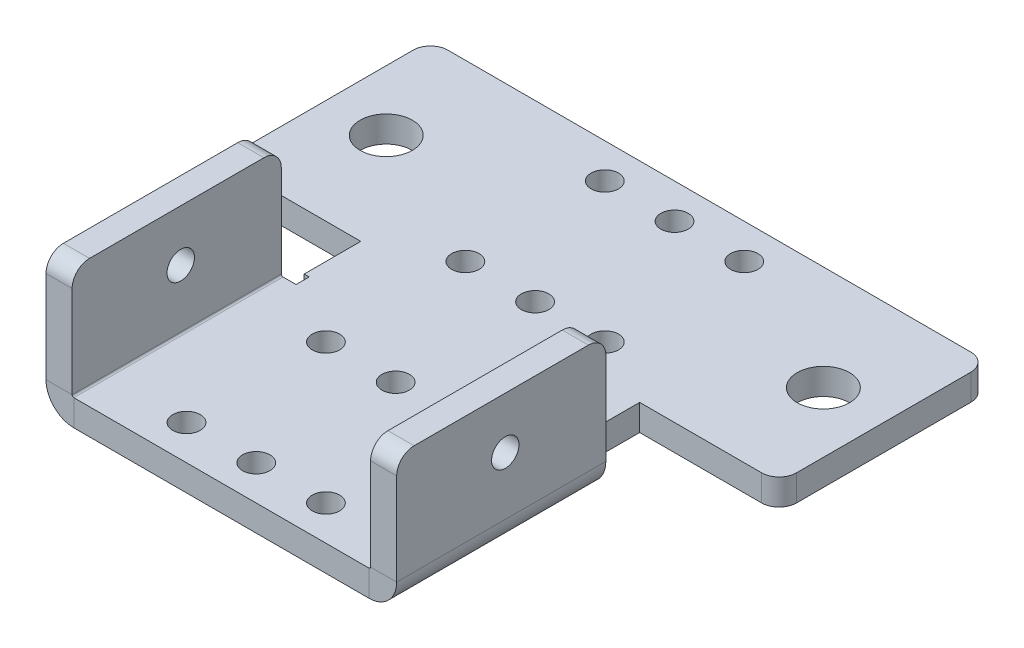
from build123d import *

# Parameters (mm, degrees)
T_LE_DE_BASE_PLI_E1_DEPTH                = 4.76
T_LE_PLI_E_SUR_AR_TE1_STRIP_W            = 19.665
T_LE_PLI_E_SUR_AR_TE1_STRIP_H            = 4.76
T_LE_PLI_E_SUR_AR_TE1_STRIP_CUT_DEPTH    = 38.1
T_LE_PLI_E_SUR_AR_TE1_RELIEF_W           = 22.045
T_LE_PLI_E_SUR_AR_TE1_RELIEF_H           = 2.38
T_LE_PLI_E_SUR_AR_TE1_RELIEF_CUT_DEPTH   = 4.76
T_LE_PLI_E_SUR_AR_TE1_STRIP_2_W          = 19.665
T_LE_PLI_E_SUR_AR_TE1_STRIP_2_H          = 4.76
T_LE_PLI_E_SUR_AR_TE1_STRIP_CUT_2_DEPTH  = 38.1
T_LE_PLI_E_SUR_AR_TE1_RELIEF_2_W         = 22.045
T_LE_PLI_E_SUR_AR_TE1_RELIEF_2_H         = 2.38
T_LE_PLI_E_SUR_AR_TE1_RELIEF_CUT_2_DEPTH = 4.76
T_LE_PLI_E_SUR_AR_TE1_DEPTH              = 38.1
T_LE_PLI_E_SUR_AR_TE1_BEND_DEPTH         = 38.1
ENL_V_MAT_EXTRU_1_REACH                  = 90.709
ESQUISSE12_W                             = 6.54
ESQUISSE12_H                             = 10.32
CONG_1_R                                 = 3.175
ESQUISSE13_R                             = 4.7625
ENL_V_MAT_EXTRU_3_DEPTH                  = 89.709188363
DIAM_TRE_DU_PER_AGE_5_0_5_1_D            = 5
R_P_TITION_LIN_AIRE1_COUNT               = 4
R_P_TITION_LIN_AIRE1_PITCH               = 25.4
DIAM_TRE_DU_PER_AGE_5_0_5_2_D            = 5
DIAM_TRE_DU_PER_AGE_5_0_5_2_DEPTH        = 4.76
DIAM_TRE_DU_PER_AGE_5_0_5_3_D            = 5


# Sheet-metal steps are written as plain solids
with BuildPart() as part:
    # Esquisse1 → Tôle de base pliée1 (new body)
    with BuildSketch(Plane(origin=(0, 0, 0), x_dir=(1, 0, 0), z_dir=(0, 1, 0))):
        Polygon((-31.94, -19.05), (-31.94, -69.85), (31.94, -69.85), (31.94, -19.05), (50.8, -19.05), (50.8, 19.05), (-50.8, 19.05), (-50.8, -19.05), align=None)
    extrude(amount=-T_LE_DE_BASE_PLI_E1_DEPTH)

    # Tôle pliée sur arête1 strip (across the edge) → Tôle pliée sur arête1 strip cut (cut)
    with BuildSketch(Plane(origin=(-31.94, 0, 31.75), x_dir=(1, 0, 0), z_dir=(0, 0, 1))):
        with Locations((-4.76, -2.38)):
            Rectangle(T_LE_PLI_E_SUR_AR_TE1_STRIP_W, T_LE_PLI_E_SUR_AR_TE1_STRIP_H)
    extrude(amount=T_LE_PLI_E_SUR_AR_TE1_STRIP_CUT_DEPTH, mode=Mode.SUBTRACT)

    # Tôle pliée sur arête1 relief (on the sheet) → Tôle pliée sur arête1 relief cut (cut)
    with BuildSketch(Plane(origin=(-26.8675, 0, 31.75), x_dir=(1, 0, 0), z_dir=(0, 1, 0))):
        with Locations((-8.6425, 1.19)):
            Rectangle(T_LE_PLI_E_SUR_AR_TE1_RELIEF_W, T_LE_PLI_E_SUR_AR_TE1_RELIEF_H)
    extrude(amount=-T_LE_PLI_E_SUR_AR_TE1_RELIEF_CUT_DEPTH, mode=Mode.SUBTRACT)

    # Tôle pliée sur arête1 strip 2 (across the edge) → Tôle pliée sur arête1 strip cut 2 (cut)
    with BuildSketch(Plane(origin=(31.94, 0, 69.85), x_dir=(-1, 0, 0), z_dir=(0, 0, -1))):
        with Locations((-4.76, -2.38)):
            Rectangle(T_LE_PLI_E_SUR_AR_TE1_STRIP_2_W, T_LE_PLI_E_SUR_AR_TE1_STRIP_2_H)
    extrude(amount=T_LE_PLI_E_SUR_AR_TE1_STRIP_CUT_2_DEPTH, mode=Mode.SUBTRACT)

    # Tôle pliée sur arête1 relief 2 (on the sheet) → Tôle pliée sur arête1 relief cut 2 (cut)
    with BuildSketch(Plane(origin=(26.8675, 0, 69.85), x_dir=(-1, 0, 0), z_dir=(0, 1, 0))):
        with Locations((-8.6425, -39.29)):
            Rectangle(T_LE_PLI_E_SUR_AR_TE1_RELIEF_2_W, T_LE_PLI_E_SUR_AR_TE1_RELIEF_2_H)
    extrude(amount=-T_LE_PLI_E_SUR_AR_TE1_RELIEF_CUT_2_DEPTH, mode=Mode.SUBTRACT)

    # Tôle pliée sur arête1 section (across the edge) → Tôle pliée sur arête1 (add)
    with BuildSketch(Plane(origin=(-31.94, 0, 31.75), x_dir=(1, 0, 0), z_dir=(0, 0, 1))):
        with BuildLine():
            Line((0, 0.3125), (0, 20.24))
            Line((0, 20.24), (4.76, 20.24))
            Line((4.76, 20.24), (4.76, 0.3125))
            ThreePointArc((4.76, 0.3125), (4.851529131, 0.091529131), (5.0725, 0))
            Line((5.0725, 0), (5.0725, -4.76))
            ThreePointArc((5.0725, -4.76), (1.485700852, -3.274299148), (0, 0.3125))
        make_face()
    extrude(amount=T_LE_PLI_E_SUR_AR_TE1_DEPTH)

    # Tôle pliée sur arête1 section 2 (across the edge) → Tôle pliée sur arête1 bend (add)
    with BuildSketch(Plane(origin=(31.94, 0, 69.85), x_dir=(-1, 0, 0), z_dir=(0, 0, -1))):
        with BuildLine():
            Line((0, 0.3125), (0, 20.24))
            Line((0, 20.24), (4.76, 20.24))
            Line((4.76, 20.24), (4.76, 0.3125))
            ThreePointArc((4.76, 0.3125), (4.851529131, 0.091529131), (5.0725, 0))
            Line((5.0725, 0), (5.0725, -4.76))
            ThreePointArc((5.0725, -4.76), (1.485700852, -3.274299148), (0, 0.3125))
        make_face()
    extrude(amount=T_LE_PLI_E_SUR_AR_TE1_BEND_DEPTH)

    # Esquisse12 → Enlèv. mat.-Extru.1 (cut, up to next)
    with BuildSketch(Plane(origin=(0, 0, 0), x_dir=(1, 0, 0), z_dir=(0, 1, 0)), mode=Mode.PRIVATE) as enl_v_mat_extru_1_sk1:
        with Locations((-28.67, -24.21)):
            Rectangle(ESQUISSE12_W, ESQUISSE12_H)
    enl_v_mat_extru_1_tool1 = extrude(enl_v_mat_extru_1_sk1.sketch, amount=-ENL_V_MAT_EXTRU_1_REACH, mode=Mode.PRIVATE) & part.part
    # Esquisse12 → Enlèv. mat.-Extru.1 (cut, up to next)
    with BuildSketch(Plane(origin=(0, 0, 0), x_dir=(1, 0, 0), z_dir=(0, 1, 0)), mode=Mode.PRIVATE) as enl_v_mat_extru_1_sk2:
        with Locations((28.67, -24.21)):
            Rectangle(ESQUISSE12_W, ESQUISSE12_H)
    enl_v_mat_extru_1_tool2 = extrude(enl_v_mat_extru_1_sk2.sketch, amount=-ENL_V_MAT_EXTRU_1_REACH, mode=Mode.PRIVATE) & part.part
    add(enl_v_mat_extru_1_tool1.solids().sort_by_distance((-28.67, 0, 24.21))[0], mode=Mode.SUBTRACT)
    add(enl_v_mat_extru_1_tool2.solids().sort_by_distance((28.67, 0, 24.21))[0], mode=Mode.SUBTRACT)

    # Congé1
    cong_1_edges = [part.edges().sort_by_distance(p)[0] for p in [
        (-50.8, -2.38, 19.05),
        (-50.8, -2.38, -19.05),
        (50.8, -2.38, -19.05),
        (50.8, -2.38, 19.05),
        (-29.56, 20.24, 31.75),
        (-29.56, 20.24, 69.85),
        (29.56, 20.24, 69.85),
        (29.56, 20.24, 31.75),
    ]]
    fillet(cong_1_edges, radius=CONG_1_R)

    # Esquisse13 → Enlèv. mat.-Extru.3 (cut, through all)
    with BuildSketch(Plane(origin=(0, 0, 0), x_dir=(1, 0, 0), z_dir=(0, 1, 0))):
        with Locations(Location((-39.8145, 0, 0), (0, 0, 270))):
            Circle(ESQUISSE13_R)
        with Locations(Location((39.8145, 0, 0), (0, 0, 90))):
            Circle(ESQUISSE13_R)
    extrude(amount=-ENL_V_MAT_EXTRU_3_DEPTH, mode=Mode.SUBTRACT)

    # Diamètre du perçage Ø5.0 (5)1 (through all)
    with Locations(Plane(origin=(0, 0, 0), x_dir=(1, 0, 0), z_dir=(0, 1, 0))):
        with Locations((-12.7, 12.7), (0, 12.7), (12.7, 12.7)):
            diam_tre_du_per_age_5_0_5_1 = Hole(DIAM_TRE_DU_PER_AGE_5_0_5_1_D / 2)

    # Répétition linéaire1: Diamètre du perçage Ø5.0 (5)1 ×4
    with Locations(*[(0, 0, i * R_P_TITION_LIN_AIRE1_PITCH) for i in range(1, R_P_TITION_LIN_AIRE1_COUNT)]):
        add(diam_tre_du_per_age_5_0_5_1, mode=Mode.SUBTRACT)

    # Diamètre du perçage Ø5.0 (5)2
    with Locations(Plane.ZY.offset(31.94)):
        with Locations((50.06794197, 10.866778695), (38.47565905, -37.875384173)):
            Hole(DIAM_TRE_DU_PER_AGE_5_0_5_2_D / 2, depth=DIAM_TRE_DU_PER_AGE_5_0_5_2_DEPTH)

    # Diamètre du perçage Ø5.0 (5)3 (through all)
    with Locations(Plane(origin=(31.94, 0, 0), x_dir=(0, 0, -1), z_dir=(1, 0, 0))):
        with Locations((-50.06794197, 10.866778695)):
            Hole(DIAM_TRE_DU_PER_AGE_5_0_5_3_D / 2)


solid = part.part
